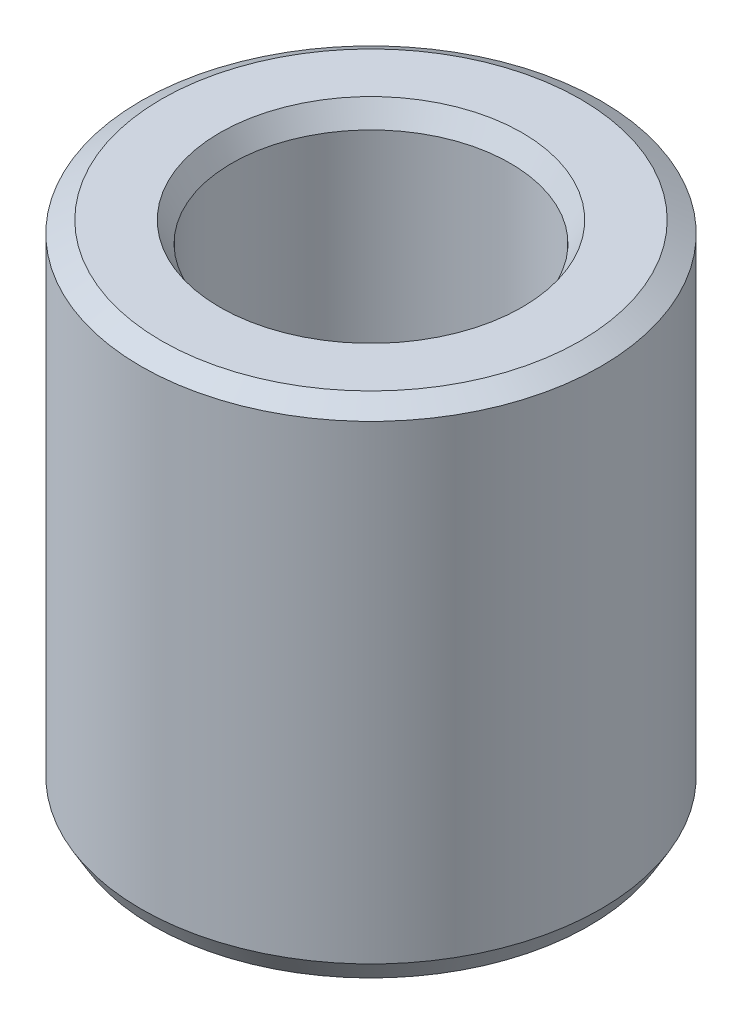
from build123d import *
from OCP.BRepFilletAPI import BRepFilletAPI_MakeChamfer

# Parameters (mm, degrees)
SKETCH1_R           = 17.5
BOSS_EXTRUDE1_DEPTH = 38.220165171
SKETCH2_R           = 10.601165028
CUT_EXTRUDE1_DEPTH  = 46.533295792
CHAMFER1_SIZE       = 0.9009788
CHAMFER1_SIZE2      = 1.560541059


with BuildPart() as part:
    # Sketch1 → Boss-Extrude1 (new body)
    with BuildSketch(Plane(origin=(0, 0, 0), x_dir=(1, 0, 0), z_dir=(0, 1, 0))):
        Circle(SKETCH1_R)
    extrude(amount=BOSS_EXTRUDE1_DEPTH)

    # Sketch2 → Cut-Extrude1 (cut, through all)
    with BuildSketch(Plane(origin=(0, 0, 0), x_dir=(1, 0, 0), z_dir=(0, 1, 0))):
        Circle(SKETCH2_R)
    extrude(amount=CUT_EXTRUDE1_DEPTH, mode=Mode.SUBTRACT)

    # Chamfer1: one chamfer whose edges measure the first distance from different faces: ONE call of the kernel's chamfer builder (chamfer() names one face for all edges)
    chamfer1_edges_1 = [part.edges().sort_by_distance(p)[0] for p in [
        (-10.601165028, 38.220165171, 0),
    ]]
    chamfer1_side_1 = [part.faces().sort_by_distance(p)[0] for p in [
        (-17.005025253, 38.220165171, 0),
    ]]
    chamfer1_edges_2 = [part.edges().sort_by_distance(p)[0] for p in [
        (-10.601165028, 0, 0),
    ]]
    chamfer1_side_2 = [part.faces().sort_by_distance(p)[0] for p in [
        (-10.601165028, 19.110082586, 0),
    ]]
    chamfer1_edges_3 = [part.edges().sort_by_distance(p)[0] for p in [
        (-17.5, 0, 0),
    ]]
    chamfer1_side_3 = [part.faces().sort_by_distance(p)[0] for p in [
        (-17.005025253, 0, 0),
    ]]
    chamfer1_edges_4 = [part.edges().sort_by_distance(p)[0] for p in [
        (-17.5, 38.220165171, 0),
    ]]
    chamfer1_side_4 = [part.faces().sort_by_distance(p)[0] for p in [
        (-17.5, 19.110082586, 0),
    ]]
    chamfer1 = BRepFilletAPI_MakeChamfer(part.part.solid().wrapped)
    for e in chamfer1_edges_1:
        chamfer1.Add(CHAMFER1_SIZE, CHAMFER1_SIZE2, e.wrapped, chamfer1_side_1[0].wrapped)  # the first distance lies on this face
    for e in chamfer1_edges_2:
        chamfer1.Add(CHAMFER1_SIZE, CHAMFER1_SIZE2, e.wrapped, chamfer1_side_2[0].wrapped)  # the first distance lies on this face
    for e in chamfer1_edges_3:
        chamfer1.Add(CHAMFER1_SIZE, CHAMFER1_SIZE2, e.wrapped, chamfer1_side_3[0].wrapped)  # the first distance lies on this face
    for e in chamfer1_edges_4:
        chamfer1.Add(CHAMFER1_SIZE, CHAMFER1_SIZE2, e.wrapped, chamfer1_side_4[0].wrapped)  # the first distance lies on this face
    add(Compound.cast(chamfer1.Shape()), mode=Mode.REPLACE)


solid = part.part
